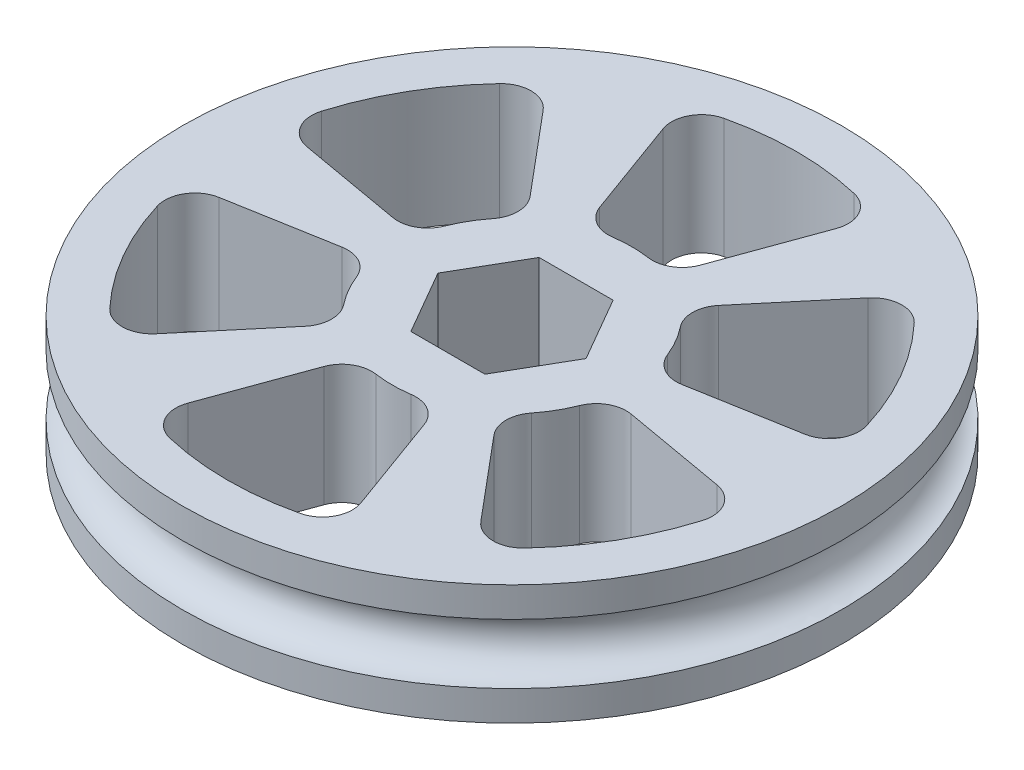
from build123d import *

# Parameters (mm, degrees)
SKETCH1_R           = 34.925
BOSS_EXTRUDE1_DEPTH = 12.7
SKETCH4_R           = 3.175
CUT_EXTRUDE1_DEPTH  = 51.998051433


with BuildPart() as part:
    # Sketch1 → Boss-Extrude1 (new body)
    with BuildSketch(Plane(origin=(0, 0, 0), x_dir=(1, 0, 0), z_dir=(0, 1, 0))):
        Circle(SKETCH1_R)
        Polygon((7.845612808, 0), (3.922806404, 6.7945), (-3.922806404, 6.7945), (-7.845612808, 0), (-3.922806404, -6.7945), (3.922806404, -6.7945), align=None, mode=Mode.SUBTRACT)
    extrude(amount=BOSS_EXTRUDE1_DEPTH)

    # Sketch4 → Cut-Revolve1 (revolve, cut)
    with BuildSketch(Plane(origin=(-6.35, 6.35, 0), x_dir=(0, 1, 0), z_dir=(0, 0, -1))):
        with Locations((0, 41.275)):
            Circle(SKETCH4_R)
    revolve(axis=Axis((0, 12.7, 0), (0, -1, 0)), mode=Mode.SUBTRACT)

    # Sketch5 → Cut-Extrude1 (cut, through all)
    with BuildSketch(Plane.XZ):
        with BuildLine():
            Line((5.319870189, 14.616223218), (9.166168755, 25.183841677))
            ThreePointArc((9.166168755, 25.183841677), (8.97610423, 27.778797966), (6.910014647, 29.360315118))
            ThreePointArc((6.910014647, 29.360315118), (0, 30.1625), (-6.910014647, 29.360315118))
            ThreePointArc((-6.910014647, 29.360315118), (-8.97610423, 27.778797966), (-9.166168755, 25.183841677))
            Line((-9.166168755, 25.183841677), (-5.319870189, 14.616223218))
            ThreePointArc((-5.319870189, 14.616223218), (-3.960581638, 12.974045537), (-1.869076894, 12.561709739))
            ThreePointArc((-1.869076894, 12.561709739), (0, 12.7), (1.869076894, 12.561709739))
            ThreePointArc((1.869076894, 12.561709739), (3.960581638, 12.974045537), (5.319870189, 14.616223218))
        make_face()
        with BuildLine():
            Line((15.317955709, 2.700968881), (26.392931035, 4.653785841))
            ThreePointArc((26.392931035, 4.653785841), (28.54519684, 6.115864693), (28.881786079, 8.695909334))
            ThreePointArc((28.881786079, 8.695909334), (26.121491242, 15.08125), (21.971771432, 20.664405784))
            ThreePointArc((21.971771432, 20.664405784), (19.56909261, 21.662933273), (17.22676228, 20.530055836))
            Line((17.22676228, 20.530055836), (9.99808552, 11.915254338))
            ThreePointArc((9.99808552, 11.915254338), (9.255562206, 9.916987081), (9.944221302, 7.899522942))
            ThreePointArc((9.944221302, 7.899522942), (10.998522628, 6.35), (11.813298196, 4.662186797))
            ThreePointArc((11.813298196, 4.662186797), (13.216143844, 3.057058457), (15.317955709, 2.700968881))
        make_face()
        with BuildLine():
            Line((9.99808552, -11.915254338), (17.22676228, -20.530055836))
            ThreePointArc((17.22676228, -20.530055836), (19.56909261, -21.662933273), (21.971771432, -20.664405784))
            ThreePointArc((21.971771432, -20.664405784), (26.121491242, -15.08125), (28.881786079, -8.695909334))
            ThreePointArc((28.881786079, -8.695909334), (28.54519684, -6.115864693), (26.392931035, -4.653785841))
            Line((26.392931035, -4.653785841), (15.317955709, -2.700968881))
            ThreePointArc((15.317955709, -2.700968881), (13.216143844, -3.057058457), (11.813298196, -4.662186797))
            ThreePointArc((11.813298196, -4.662186797), (10.998522628, -6.35), (9.944221302, -7.899522942))
            ThreePointArc((9.944221302, -7.899522942), (9.255562206, -9.916987081), (9.99808552, -11.915254338))
        make_face()
        with BuildLine():
            Line((-5.319870189, -14.616223218), (-9.166168755, -25.183841677))
            ThreePointArc((-9.166168755, -25.183841677), (-8.97610423, -27.778797966), (-6.910014647, -29.360315118))
            ThreePointArc((-6.910014647, -29.360315118), (0, -30.1625), (6.910014647, -29.360315118))
            ThreePointArc((6.910014647, -29.360315118), (8.97610423, -27.778797966), (9.166168755, -25.183841677))
            Line((9.166168755, -25.183841677), (5.319870189, -14.616223218))
            ThreePointArc((5.319870189, -14.616223218), (3.960581638, -12.974045537), (1.869076894, -12.561709739))
            ThreePointArc((1.869076894, -12.561709739), (0, -12.7), (-1.869076894, -12.561709739))
            ThreePointArc((-1.869076894, -12.561709739), (-3.960581638, -12.974045537), (-5.319870189, -14.616223218))
        make_face()
        with BuildLine():
            Line((-15.317955709, -2.700968881), (-26.392931035, -4.653785841))
            ThreePointArc((-26.392931035, -4.653785841), (-28.54519684, -6.115864693), (-28.881786079, -8.695909334))
            ThreePointArc((-28.881786079, -8.695909334), (-26.121491242, -15.08125), (-21.971771432, -20.664405784))
            ThreePointArc((-21.971771432, -20.664405784), (-19.56909261, -21.662933273), (-17.22676228, -20.530055836))
            Line((-17.22676228, -20.530055836), (-9.99808552, -11.915254338))
            ThreePointArc((-9.99808552, -11.915254338), (-9.255562206, -9.916987081), (-9.944221302, -7.899522942))
            ThreePointArc((-9.944221302, -7.899522942), (-10.998522628, -6.35), (-11.813298196, -4.662186797))
            ThreePointArc((-11.813298196, -4.662186797), (-13.216143844, -3.057058457), (-15.317955709, -2.700968881))
        make_face()
        with BuildLine():
            Line((-9.99808552, 11.915254338), (-17.22676228, 20.530055836))
            ThreePointArc((-17.22676228, 20.530055836), (-19.56909261, 21.662933273), (-21.971771432, 20.664405784))
            ThreePointArc((-21.971771432, 20.664405784), (-26.121491242, 15.08125), (-28.881786079, 8.695909334))
            ThreePointArc((-28.881786079, 8.695909334), (-28.54519684, 6.115864693), (-26.392931035, 4.653785841))
            Line((-26.392931035, 4.653785841), (-15.317955709, 2.700968881))
            ThreePointArc((-15.317955709, 2.700968881), (-13.216143844, 3.057058457), (-11.813298196, 4.662186797))
            ThreePointArc((-11.813298196, 4.662186797), (-10.998522628, 6.35), (-9.944221302, 7.899522942))
            ThreePointArc((-9.944221302, 7.899522942), (-9.255562206, 9.916987081), (-9.99808552, 11.915254338))
        make_face()
    extrude(amount=-CUT_EXTRUDE1_DEPTH, mode=Mode.SUBTRACT)


solid = part.part
